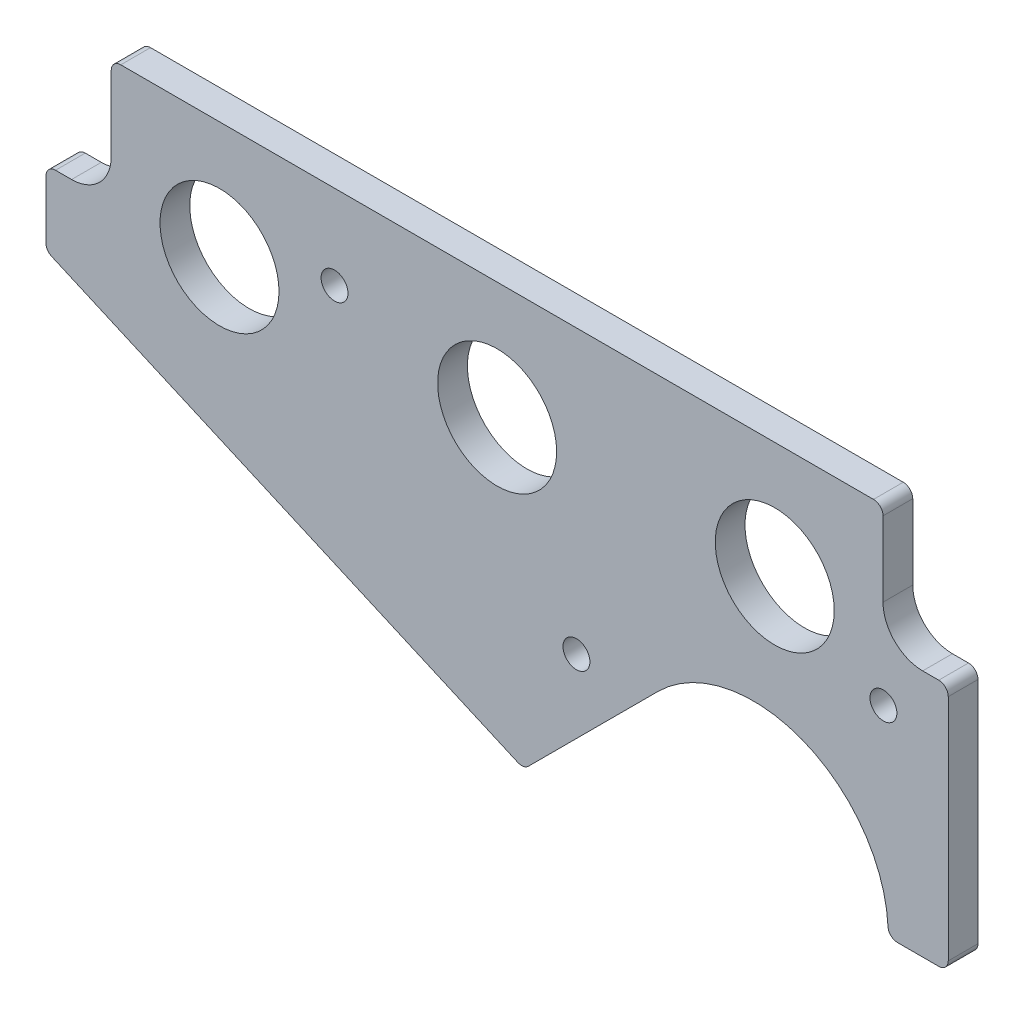
from build123d import *

# Parameters (mm, degrees)
BOSS_EXTRUDE1_DEPTH   = 4.7625
F_6_CLEARANCE_HOLE1_D = 4.3053
SKETCH5_R             = 9.525
CUT_EXTRUDE1_DEPTH    = 6026.453213925


with BuildPart() as part:
    # Sketch1 → Boss-Extrude1 (new body)
    with BuildSketch(Plane.XY.offset(-34.431186078)):
        with BuildLine():
            Line((-842.127056947, 5946.106287623), (-962.650056947, 5946.106287623))
            ThreePointArc((-962.650056947, 5946.106287623), (-963.727687681, 5945.659918357), (-964.174056947, 5944.582287623))
            Line((-964.174056947, 5944.582287623), (-964.174056947, 5932.612537623))
            ThreePointArc((-964.174056947, 5932.612537623), (-966.033928886, 5928.122409562), (-970.524056947, 5926.262537623))
            Line((-970.524056947, 5926.262537623), (-973.095806947, 5926.262537623))
            ThreePointArc((-973.095806947, 5926.262537623), (-974.173437681, 5925.816168357), (-974.619806947, 5924.738537623))
            Line((-974.619806947, 5924.738537623), (-974.619806947, 5915.392415905))
            ThreePointArc((-974.619806947, 5915.392415905), (-974.372123334, 5914.559593907), (-973.709580595, 5913.997475796))
            Line((-973.709580595, 5913.997475796), (-899.073125038, 5881.157435351))
            ThreePointArc((-899.073125038, 5881.157435351), (-898.178349327, 5881.054505693), (-897.381720655, 5881.474744726))
            Line((-897.381720655, 5881.474744726), (-876.633992352, 5902.222473029))
            ThreePointArc((-876.633992352, 5902.222473029), (-853.601284124, 5907.100841083), (-839.803970731, 5888.023674985))
            ThreePointArc((-839.803970731, 5888.023674985), (-839.332483448, 5886.99508367), (-838.281835234, 5886.575037623))
            Line((-838.281835234, 5886.575037623), (-831.681306947, 5886.575037623))
            ThreePointArc((-831.681306947, 5886.575037623), (-830.603676212, 5887.021406888), (-830.157306947, 5888.099037623))
            Line((-830.157306947, 5888.099037623), (-830.157306947, 5924.738537623))
            ThreePointArc((-830.157306947, 5924.738537623), (-830.603676212, 5925.816168357), (-831.681306947, 5926.262537623))
            Line((-831.681306947, 5926.262537623), (-834.253056947, 5926.262537623))
            ThreePointArc((-834.253056947, 5926.262537623), (-838.743185007, 5928.122409562), (-840.603056947, 5932.612537623))
            Line((-840.603056947, 5932.612537623), (-840.603056947, 5944.582287623))
            ThreePointArc((-840.603056947, 5944.582287623), (-841.049426212, 5945.659918357), (-842.127056947, 5946.106287623))
        make_face()
    extrude(amount=BOSS_EXTRUDE1_DEPTH)

    # #6 Clearance Hole1 (through all)
    with Locations(Plane.XY.offset(-29.668686078)):
        with Locations((-840.539556947, 5918.325037623), (-889.688556947, 5900.862537623), (-928.423556947, 5932.612537623)):
            Hole(F_6_CLEARANCE_HOLE1_D / 2)

    # Sketch5 → Cut-Extrude1 (cut, through all)
    with BuildSketch(Plane.XY.offset(-29.668686078)):
        with Locations((-857.938556947, 5927.524153596)):
            Circle(SKETCH5_R)
        with Locations((-902.388556947, 5927.342037623)):
            Circle(SKETCH5_R)
        with Locations((-946.838556947, 5927.342037623)):
            Circle(SKETCH5_R)
    extrude(amount=-CUT_EXTRUDE1_DEPTH, mode=Mode.SUBTRACT)


solid = part.part
